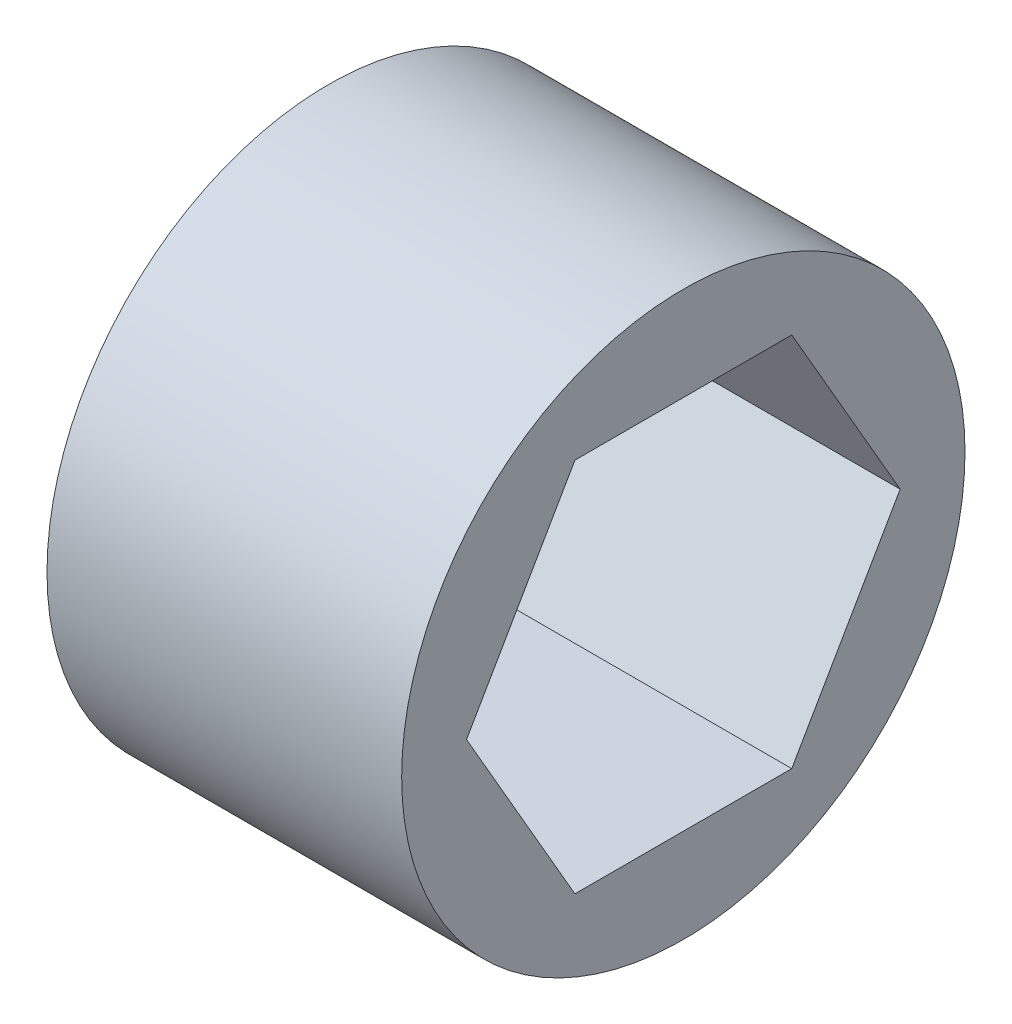
from build123d import *

# Parameters (mm, degrees)
SKETCH1_R           = 9.525
BOSS_EXTRUDE1_DEPTH = 11.993992776


with BuildPart() as part:
    # Sketch1 → Boss-Extrude1 (new body)
    with BuildSketch(Plane(origin=(0, 0, 0), x_dir=(0, 0, -1), z_dir=(1, 0, 0))):
        Circle(SKETCH1_R)
        Polygon((7.332348419, 0), (3.666174209, 6.35), (-3.666174209, 6.35), (-7.332348419, 0), (-3.666174209, -6.35), (3.666174209, -6.35), align=None, mode=Mode.SUBTRACT)
    extrude(amount=BOSS_EXTRUDE1_DEPTH)


solid = part.part
